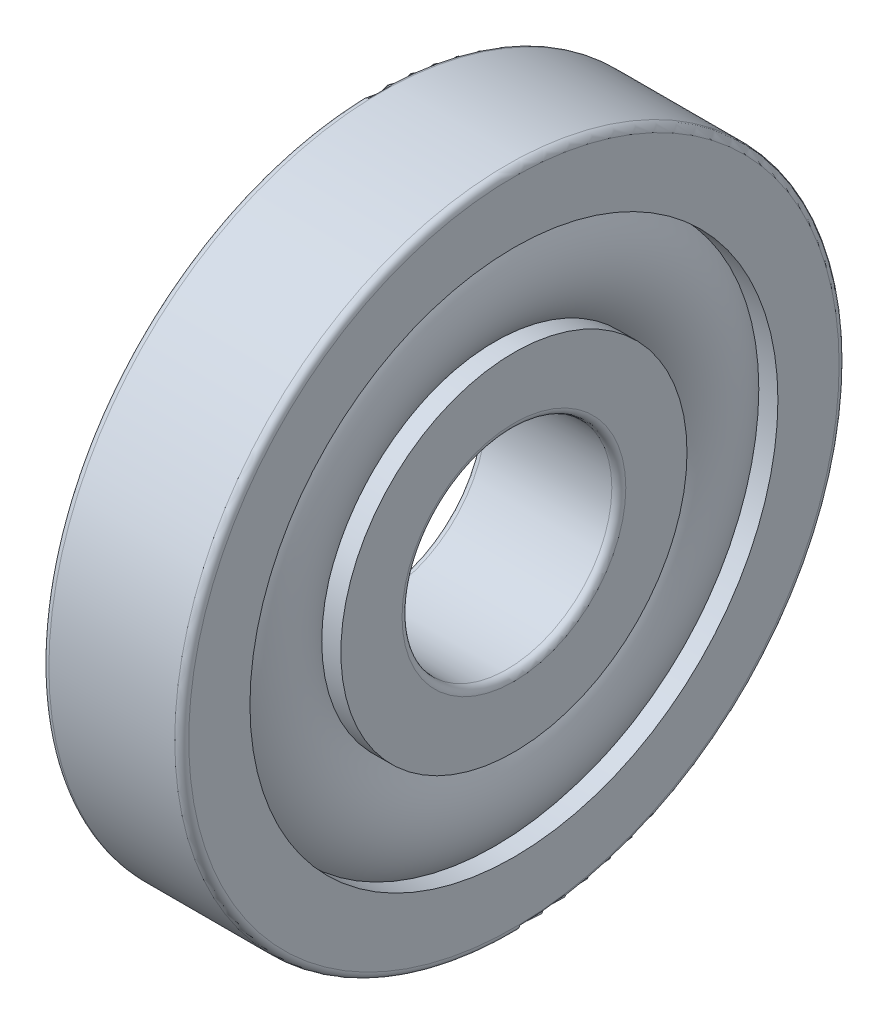
from build123d import *

# Parameters (mm, degrees)
CAGSPISKE_W     = 0.39
CAGSPISKE_H     = 0.65
CAGESPINE_ANGLE = 0.001
BALSIMSKE_R     = 1.95


with BuildPart() as part:
    # CagSpiSke → CageSpine (revolve)
    with BuildSketch(Plane.XY):
        with Locations((0, 6.25)):
            Rectangle(CAGSPISKE_W, CAGSPISKE_H)
    revolve(axis=Axis((-20.6375, 0, 0), (-1, 0, 0)), revolution_arc=CAGESPINE_ANGLE)

    # BalSimSke → BallsSimplified (revolve)
    with BuildSketch(Plane.XY):
        with Locations((0, 6.25)):
            Circle(BALSIMSKE_R)
    revolve(axis=Axis((-10, 0, 0), (1, 0, 0)))

    # InnRacSke → InnerRace (revolve)
    with BuildSketch(Plane.XY):
        with BuildLine():
            Line((-1.419727086, 4.95), (-2, 4.95))
            Line((-2, 4.95), (-2, 3.2))
            ThreePointArc((-2, 3.2), (-1.941421356, 3.058578644), (-1.8, 3))
            Line((-1.8, 3), (1.8, 3))
            ThreePointArc((1.8, 3), (1.941421356, 3.058578644), (2, 3.2))
            Line((2, 3.2), (2, 4.95))
            Line((2, 4.95), (1.419727086, 4.95))
            ThreePointArc((1.419727086, 4.95), (0, 4.325), (-1.419727086, 4.95))
        make_face()
    revolve(axis=Axis((-20.6375, 0, 0), (1, 0, 0)))

    # OutRacSke → OuterRace (revolve)
    with BuildSketch(Plane.XY):
        with BuildLine():
            Line((-1.419727086, 7.55), (-2, 7.55))
            Line((-2, 7.55), (-2, 9.3))
            ThreePointArc((-2, 9.3), (-1.941421356, 9.441421356), (-1.8, 9.5))
            Line((-1.8, 9.5), (1.8, 9.5))
            ThreePointArc((1.8, 9.5), (1.941421356, 9.441421356), (2, 9.3))
            Line((2, 9.3), (2, 7.55))
            Line((2, 7.55), (1.419727086, 7.55))
            ThreePointArc((1.419727086, 7.55), (0, 8.175), (-1.419727086, 7.55))
        make_face()
    revolve(axis=Axis((-20.6375, 0, 0), (1, 0, 0)))


solid = part.part
